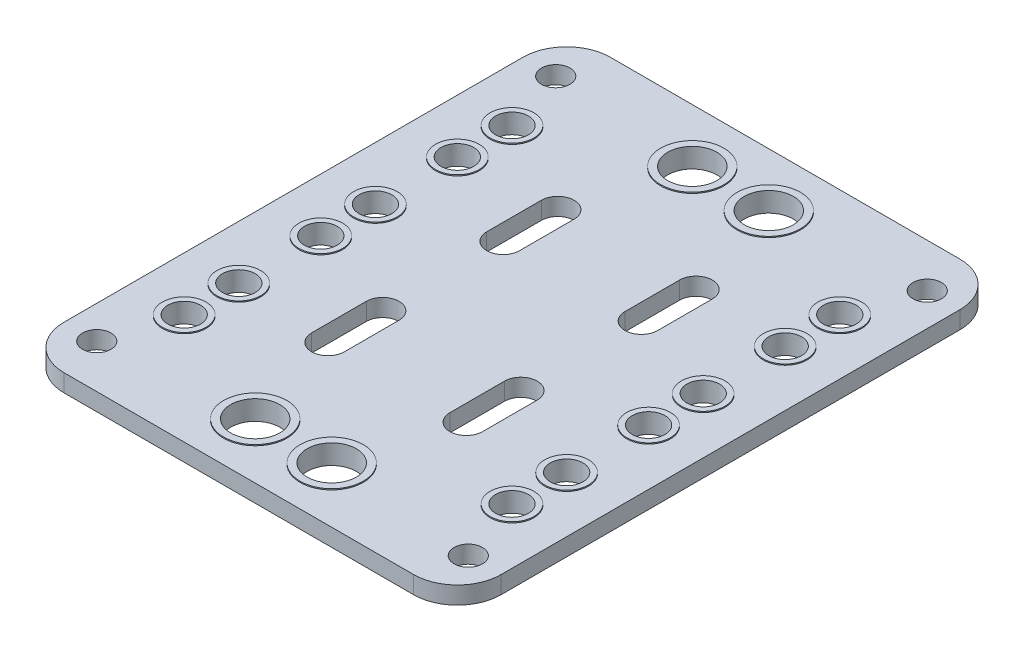
from build123d import *

# Parameters (mm, degrees)
SALIENTE_EXTRUIR1_DEPTH    = 0.8
CORTAR_EXTRUIR1_DEPTH      = 33.055576738
CORTAR_EXTRUIR1_DEPTH_BACK = 33.055576738
CROQUIS2_R                 = 1.3
CROQUIS6_R                 = 2.25
CROQUIS6_R_2               = 1.5
CORTAR_EXTRUIR3_DEPTH      = 33.055576738
CROQUIS7_R                 = 2
CROQUIS7_R_2               = 1.5
CROQUIS7_R_3               = 2.894896359
CROQUIS7_R_4               = 2.25
SALIENTE_EXTRUIR3_DEPTH    = 0.9


with BuildPart() as part:
    # Croquis1 → Saliente-Extruir1 (new, symmetric)
    with BuildSketch(Plane(origin=(0, 0, 0), x_dir=(1, 0, 0), z_dir=(0, 1, 0))):
        with BuildLine():
            Line((-16, 25), (16, 25))
            ThreePointArc((16, 25), (18.828427125, 23.828427125), (20, 21))
            Line((20, 21), (20, -21))
            ThreePointArc((20, -21), (18.828427125, -23.828427125), (16, -25))
            Line((16, -25), (-16, -25))
            ThreePointArc((-16, -25), (-18.828427125, -23.828427125), (-20, -21))
            Line((-20, -21), (-20, 21))
            ThreePointArc((-20, 21), (-18.828427125, 23.828427125), (-16, 25))
        make_face()
    extrude(amount=SALIENTE_EXTRUIR1_DEPTH, both=True)

    # Croquis2 → Cortar-Extruir1 (cut, two sides: drawn at the far end of the back side and taken through both)
    with BuildSketch(Plane(origin=(0, 0.8, 0), x_dir=(1, 0, 0), z_dir=(0, 1, 0)).offset(-CORTAR_EXTRUIR1_DEPTH_BACK)):
        with Locations((-17, 21)):
            Circle(CROQUIS2_R)
        with Locations((17, 21)):
            Circle(CROQUIS2_R)
        with Locations((17, -21)):
            Circle(CROQUIS2_R)
        with Locations((-17, -21)):
            Circle(CROQUIS2_R)
    extrude(amount=CORTAR_EXTRUIR1_DEPTH + CORTAR_EXTRUIR1_DEPTH_BACK, mode=Mode.SUBTRACT)

    # Croquis6 → Cortar-Extruir3 (cut, through all)
    with BuildSketch(Plane(origin=(0, 0.8, 0), x_dir=(1, 0, 0), z_dir=(0, 1, 0))):
        with Locations((-3.5, 20)):
            Circle(CROQUIS6_R)
        with Locations((3.5, 20)):
            Circle(CROQUIS6_R)
        with Locations((-15, 2.5)):
            Circle(CROQUIS6_R_2)
        with Locations((-15, -2.5)):
            Circle(CROQUIS6_R_2)
        with Locations((-15, 10)):
            Circle(CROQUIS6_R_2)
        with Locations((-15, 15)):
            Circle(CROQUIS6_R_2)
        with Locations((-15, -10)):
            Circle(CROQUIS6_R_2)
        with Locations((-15, -15)):
            Circle(CROQUIS6_R_2)
        with Locations((15, -15)):
            Circle(CROQUIS6_R_2)
        with Locations((15, -10)):
            Circle(CROQUIS6_R_2)
        with Locations((15, 15)):
            Circle(CROQUIS6_R_2)
        with Locations((15, 10)):
            Circle(CROQUIS6_R_2)
        with Locations((15, -2.5)):
            Circle(CROQUIS6_R_2)
        with Locations((15, 2.5)):
            Circle(CROQUIS6_R_2)
        with Locations((3.5, -20)):
            Circle(CROQUIS6_R)
        with Locations((-3.5, -20)):
            Circle(CROQUIS6_R)
        with BuildLine():
            Line((-4.824898897, 10.512463512), (-4.824898897, 5.512463512))
            ThreePointArc((-4.824898897, 5.512463512), (-6.324898897, 4.012463512), (-7.824898897, 5.512463512))
            Line((-7.824898897, 5.512463512), (-7.824898897, 10.512463512))
            ThreePointArc((-7.824898897, 10.512463512), (-6.324898897, 12.012463512), (-4.824898897, 10.512463512))
        make_face()
        with BuildLine():
            Line((4.824898897, 10.512463512), (4.824898897, 5.512463512))
            ThreePointArc((4.824898897, 5.512463512), (6.324898897, 4.012463512), (7.824898897, 5.512463512))
            Line((7.824898897, 5.512463512), (7.824898897, 10.512463512))
            ThreePointArc((7.824898897, 10.512463512), (6.324898897, 12.012463512), (4.824898897, 10.512463512))
        make_face()
        with BuildLine():
            Line((-4.824898897, -10.512463512), (-4.824898897, -5.512463512))
            ThreePointArc((-4.824898897, -5.512463512), (-6.324898897, -4.012463512), (-7.824898897, -5.512463512))
            Line((-7.824898897, -5.512463512), (-7.824898897, -10.512463512))
            ThreePointArc((-7.824898897, -10.512463512), (-6.324898897, -12.012463512), (-4.824898897, -10.512463512))
        make_face()
        with BuildLine():
            Line((4.824898897, -10.512463512), (4.824898897, -5.512463512))
            ThreePointArc((4.824898897, -5.512463512), (6.324898897, -4.012463512), (7.824898897, -5.512463512))
            Line((7.824898897, -5.512463512), (7.824898897, -10.512463512))
            ThreePointArc((7.824898897, -10.512463512), (6.324898897, -12.012463512), (4.824898897, -10.512463512))
        make_face()
    extrude(amount=-CORTAR_EXTRUIR3_DEPTH, mode=Mode.SUBTRACT)

    # Croquis7 → Saliente-Extruir3 (add, symmetric)
    # profile 1 of 16: a face of its own
    with BuildSketch(Plane(origin=(0, 0, 0), x_dir=(1, 0, 0), z_dir=(0, 1, 0))):
        with Locations((-15, 15)):
            Circle(CROQUIS7_R)
        with Locations((-15, 15)):
            Circle(CROQUIS7_R_2, mode=Mode.SUBTRACT)
    # profile 2 of 16: a face of its own
    with BuildSketch(Plane(origin=(0, 0, 0), x_dir=(1, 0, 0), z_dir=(0, 1, 0))):
        with Locations((-15, 10)):
            Circle(CROQUIS7_R)
        with Locations((-15, 10)):
            Circle(CROQUIS7_R_2, mode=Mode.SUBTRACT)
    # profile 3 of 16: a face of its own
    with BuildSketch(Plane(origin=(0, 0, 0), x_dir=(1, 0, 0), z_dir=(0, 1, 0))):
        with Locations((-15, 2.5)):
            Circle(CROQUIS7_R)
        with Locations((-15, 2.5)):
            Circle(CROQUIS7_R_2, mode=Mode.SUBTRACT)
    # profile 4 of 16: a face of its own
    with BuildSketch(Plane(origin=(0, 0, 0), x_dir=(1, 0, 0), z_dir=(0, 1, 0))):
        with Locations((-15, -2.5)):
            Circle(CROQUIS7_R)
        with Locations((-15, -2.5)):
            Circle(CROQUIS7_R_2, mode=Mode.SUBTRACT)
    # profile 5 of 16: a face of its own
    with BuildSketch(Plane(origin=(0, 0, 0), x_dir=(1, 0, 0), z_dir=(0, 1, 0))):
        with Locations((-15, -15)):
            Circle(CROQUIS7_R)
        with Locations((-15, -15)):
            Circle(CROQUIS7_R_2, mode=Mode.SUBTRACT)
    # profile 6 of 16: a face of its own
    with BuildSketch(Plane(origin=(0, 0, 0), x_dir=(1, 0, 0), z_dir=(0, 1, 0))):
        with Locations((-15, -10)):
            Circle(CROQUIS7_R)
        with Locations((-15, -10)):
            Circle(CROQUIS7_R_2, mode=Mode.SUBTRACT)
    # profile 7 of 16: a face of its own
    with BuildSketch(Plane(origin=(0, 0, 0), x_dir=(1, 0, 0), z_dir=(0, 1, 0))):
        with Locations((-3.5, 20)):
            Circle(CROQUIS7_R_3)
        with Locations((-3.5, 20)):
            Circle(CROQUIS7_R_4, mode=Mode.SUBTRACT)
    # profile 8 of 16: a face of its own
    with BuildSketch(Plane(origin=(0, 0, 0), x_dir=(1, 0, 0), z_dir=(0, 1, 0))):
        with Locations((3.5, 20)):
            Circle(CROQUIS7_R_3)
        with Locations((3.5, 20)):
            Circle(CROQUIS7_R_4, mode=Mode.SUBTRACT)
    # profile 9 of 16: a face of its own
    with BuildSketch(Plane(origin=(0, 0, 0), x_dir=(1, 0, 0), z_dir=(0, 1, 0))):
        with Locations((15, -10)):
            Circle(CROQUIS7_R)
        with Locations((15, -10)):
            Circle(CROQUIS7_R_2, mode=Mode.SUBTRACT)
    # profile 10 of 16: a face of its own
    with BuildSketch(Plane(origin=(0, 0, 0), x_dir=(1, 0, 0), z_dir=(0, 1, 0))):
        with Locations((15, -15)):
            Circle(CROQUIS7_R)
        with Locations((15, -15)):
            Circle(CROQUIS7_R_2, mode=Mode.SUBTRACT)
    # profile 11 of 16: a face of its own
    with BuildSketch(Plane(origin=(0, 0, 0), x_dir=(1, 0, 0), z_dir=(0, 1, 0))):
        with Locations((15, -2.5)):
            Circle(CROQUIS7_R)
        with Locations((15, -2.5)):
            Circle(CROQUIS7_R_2, mode=Mode.SUBTRACT)
    # profile 12 of 16: a face of its own
    with BuildSketch(Plane(origin=(0, 0, 0), x_dir=(1, 0, 0), z_dir=(0, 1, 0))):
        with Locations((15, 2.5)):
            Circle(CROQUIS7_R)
        with Locations((15, 2.5)):
            Circle(CROQUIS7_R_2, mode=Mode.SUBTRACT)
    # profile 13 of 16: a face of its own
    with BuildSketch(Plane(origin=(0, 0, 0), x_dir=(1, 0, 0), z_dir=(0, 1, 0))):
        with Locations((15, 10)):
            Circle(CROQUIS7_R)
        with Locations((15, 10)):
            Circle(CROQUIS7_R_2, mode=Mode.SUBTRACT)
    # profile 14 of 16: a face of its own
    with BuildSketch(Plane(origin=(0, 0, 0), x_dir=(1, 0, 0), z_dir=(0, 1, 0))):
        with Locations((15, 15)):
            Circle(CROQUIS7_R)
        with Locations((15, 15)):
            Circle(CROQUIS7_R_2, mode=Mode.SUBTRACT)
    # profile 15 of 16: a face of its own
    with BuildSketch(Plane(origin=(0, 0, 0), x_dir=(1, 0, 0), z_dir=(0, 1, 0))):
        with Locations((3.5, -20)):
            Circle(CROQUIS7_R_3)
        with Locations((3.5, -20)):
            Circle(CROQUIS7_R_4, mode=Mode.SUBTRACT)
    # profile 16 of 16: a face of its own
    with BuildSketch(Plane(origin=(0, 0, 0), x_dir=(1, 0, 0), z_dir=(0, 1, 0))):
        with Locations((-3.5, -20)):
            Circle(CROQUIS7_R_3)
        with Locations((-3.5, -20)):
            Circle(CROQUIS7_R_4, mode=Mode.SUBTRACT)
    extrude(amount=SALIENTE_EXTRUIR3_DEPTH, both=True)


solid = part.part
